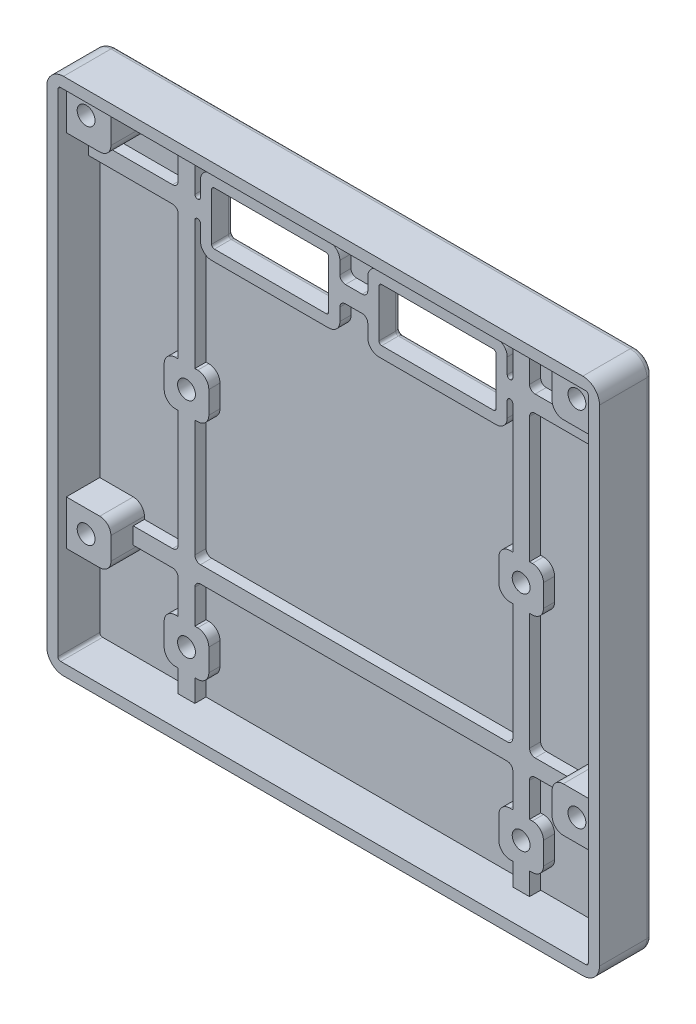
from build123d import *

# Parameters (mm, degrees)
SKETCH_1_W               = 99.1
SKETCH_1_H               = 93.1
EXTRUDE_1_DEPTH          = 2
SKETCH_2_W               = 99.1
SKETCH_2_H               = 93.1
SKETCH_2_W_2             = 95.1
SKETCH_2_H_2             = 89.1
EXTRUDE_2_DEPTH          = 7.5
SKETCH_2_3_W             = 8
SKETCH_2_3_H             = 8
EXTRUDE_3_DEPTH          = 6
SKETCH_2_4_W             = 5
SKETCH_2_4_H             = 3
SKETCH_2_4_W_2           = 25
SKETCH_2_4_H_2           = 13.5
SKETCH_2_4_W_3           = 21
SKETCH_2_4_H_3           = 9.5
SKETCH_2_4_W_4           = 8
SKETCH_2_4_H_4           = 8
SKETCH_2_4_R             = 1.6
SKETCH_2_4_W_5           = 3
SKETCH_2_4_H_5           = 4
EXTRUDE_4_DEPTH          = 2
CUT_EXTRUDE_1_DEPTH      = 69.398501446
CUT_EXTRUDE_1_DEPTH_BACK = 69.398501446
SKETCH_2_5_W             = 21
SKETCH_2_5_H             = 9.5
SKETCH_2_5_R             = 1.6
FILLET_1_R               = 3
FILLET_2_R               = 2
FILLET_3_R               = 0.5
FILLET_4_R               = 0.5
FILLET_5_R               = 1
FILLET_6_R               = 1


with BuildPart() as part:
    # Эскиз1 → Бобышка-Вытянуть1 (new body)
    with BuildSketch(Plane.XY):
        Rectangle(SKETCH_1_W, SKETCH_1_H)
    extrude(amount=EXTRUDE_1_DEPTH)

    # Эскиз2 → Бобышка-Вытянуть2 (add)
    with BuildSketch(Plane.XY.offset(2)):
        Rectangle(SKETCH_2_W, SKETCH_2_H)
        Rectangle(SKETCH_2_W_2, SKETCH_2_H_2, mode=Mode.SUBTRACT)
    extrude(amount=EXTRUDE_2_DEPTH)

    # Эскиз2<3> → Бобышка-Вытянуть3 (add)
    with BuildSketch(Plane.XY.offset(2)):
        with Locations((-43.55, 40.55)):
            Rectangle(SKETCH_2_3_W, SKETCH_2_3_H)
        with Locations((43.55, 40.55)):
            Rectangle(SKETCH_2_3_W, SKETCH_2_3_H)
        with Locations((43.55, -24)):
            Rectangle(SKETCH_2_3_W, SKETCH_2_3_H)
        with Locations((-43.55, -24)):
            Rectangle(SKETCH_2_3_W, SKETCH_2_3_H)
    extrude(amount=EXTRUDE_3_DEPTH)

    # Эскиз2<4> → Бобышка-Вытянуть4 (add)
    # profile 1 of 12: a face of its own
    with BuildSketch(Plane.XY.offset(2)):
        Polygon((-47.55, 34), (-47.55, 31), (-31.5, 31), (-31.5, 7.45), (-28.5, 7.45), (-28.5, 31), (-27.5, 31), (-27.5, 34), (-28.5, 34), (-28.5, 44.55), (-31.5, 44.55), (-31.5, 34), align=None)
    # profile 2 of 12: a face of its own
    with BuildSketch(Plane.XY.offset(2)):
        with Locations((0, 32.5)):
            Rectangle(SKETCH_2_4_W, SKETCH_2_4_H)
    # profile 3 of 12: a face of its own
    with BuildSketch(Plane.XY.offset(2)):
        with Locations((-15, 32.5)):
            Rectangle(SKETCH_2_4_W_2, SKETCH_2_4_H_2)
        with Locations((-15, 32.5)):
            Rectangle(SKETCH_2_4_W_3, SKETCH_2_4_H_3, mode=Mode.SUBTRACT)
    # profile 4 of 12: a face of its own
    with BuildSketch(Plane.XY.offset(2)):
        with Locations((15, 32.5)):
            Rectangle(SKETCH_2_4_W_2, SKETCH_2_4_H_2)
        with Locations((15, 32.5)):
            Rectangle(SKETCH_2_4_W_3, SKETCH_2_4_H_3, mode=Mode.SUBTRACT)
    # profile 5 of 12: a face of its own
    with BuildSketch(Plane.XY.offset(2)):
        Polygon((31.5, 31), (47.55, 31), (47.55, 34), (31.5, 34), (31.5, 44.55), (28.5, 44.55), (28.5, 34), (27.5, 34), (27.5, 31), (28.5, 31), (28.5, 7.45), (31.5, 7.45), align=None)
    # profile 6 of 12: a face of its own
    with BuildSketch(Plane.XY.offset(2)):
        with Locations((30, 3.45)):
            Rectangle(SKETCH_2_4_W_4, SKETCH_2_4_H_4)
        with Locations((30, 3.45)):
            Circle(SKETCH_2_4_R, mode=Mode.SUBTRACT)
    # profile 7 of 12: a face of its own
    with BuildSketch(Plane.XY.offset(2)):
        Polygon((31.5, -25.5), (39.55, -25.5), (39.55, -22.5), (31.5, -22.5), (31.5, -0.55), (28.5, -0.55), (28.5, -22.5), (-28.5, -22.5), (-28.5, -0.55), (-31.5, -0.55), (-31.5, -22.5), (-39.55, -22.5), (-39.55, -25.5), (-31.5, -25.5), (-31.5, -32.55), (-28.5, -32.55), (-28.5, -25.5), (28.5, -25.5), (28.5, -32.55), (31.5, -32.55), align=None)
    # profile 8 of 12: a face of its own
    with BuildSketch(Plane.XY.offset(2)):
        with Locations((-30, -36.55)):
            Rectangle(SKETCH_2_4_W_4, SKETCH_2_4_H_4)
        with Locations((-30, -36.55)):
            Circle(SKETCH_2_4_R, mode=Mode.SUBTRACT)
    # profile 9 of 12: a face of its own
    with BuildSketch(Plane.XY.offset(2)):
        with Locations((-30, -42.55)):
            Rectangle(SKETCH_2_4_W_5, SKETCH_2_4_H_5)
    # profile 10 of 12: a face of its own
    with BuildSketch(Plane.XY.offset(2)):
        with Locations((-30, 3.45)):
            Rectangle(SKETCH_2_4_W_4, SKETCH_2_4_H_4)
        with Locations((-30, 3.45)):
            Circle(SKETCH_2_4_R, mode=Mode.SUBTRACT)
    # profile 11 of 12: a face of its own
    with BuildSketch(Plane.XY.offset(2)):
        with Locations((30, -36.55)):
            Rectangle(SKETCH_2_4_W_4, SKETCH_2_4_H_4)
        with Locations((30, -36.55)):
            Circle(SKETCH_2_4_R, mode=Mode.SUBTRACT)
    # profile 12 of 12: a face of its own
    with BuildSketch(Plane.XY.offset(2)):
        with Locations((30, -42.55)):
            Rectangle(SKETCH_2_4_W_5, SKETCH_2_4_H_5)
    extrude(amount=EXTRUDE_4_DEPTH)

    # Эскиз2<5> → Вырез-Вытянуть1 (cut, two sides: drawn at the far end of the back side and taken through both)
    with BuildSketch(Plane.XY.offset(2).offset(-CUT_EXTRUDE_1_DEPTH_BACK)):
        with Locations((-15, 32.5)):
            Rectangle(SKETCH_2_5_W, SKETCH_2_5_H)
        with Locations((15, 32.5)):
            Rectangle(SKETCH_2_5_W, SKETCH_2_5_H)
        with Locations((-44, 41)):
            Circle(SKETCH_2_5_R)
        with Locations((-30, 3.45)):
            Circle(SKETCH_2_5_R)
        with Locations((-44, -24)):
            Circle(SKETCH_2_5_R)
        with Locations((-30, -36.55)):
            Circle(SKETCH_2_5_R)
        with Locations((30, -36.55)):
            Circle(SKETCH_2_5_R)
        with Locations((44, -24)):
            Circle(SKETCH_2_5_R)
        with Locations((30, 3.45)):
            Circle(SKETCH_2_5_R)
        with Locations((44, 41)):
            Circle(SKETCH_2_5_R)
    extrude(amount=CUT_EXTRUDE_1_DEPTH + CUT_EXTRUDE_1_DEPTH_BACK, mode=Mode.SUBTRACT)

    # Скругление1
    fillet_1_edges = [part.edges().sort_by_distance(p)[0] for p in [
        (49.55, -46.55, 4.75),
        (-49.55, -46.55, 4.75),
        (-49.55, 46.55, 4.75),
        (49.55, 46.55, 4.75),
    ]]
    fillet(fillet_1_edges, radius=FILLET_1_R)

    # Скругление2
    fillet_2_edges = [part.edges().sort_by_distance(p)[0] for p in [
        (26, 7.45, 3),
        (26, -0.55, 3),
        (-26, -0.55, 3),
        (-26, 7.45, 3),
        (-27.5, 25.75, 3),
        (-2.5, 25.75, 3),
        (2.5, 25.75, 3),
        (27.5, 25.75, 3),
        (34, 7.45, 3),
        (27.5, 39.25, 3),
        (2.5, 39.25, 3),
        (-2.5, 39.25, 3),
        (-27.5, 39.25, 3),
        (-34, 7.45, 3),
        (-34, -0.55, 3),
        (-34, -32.55, 3),
        (-34, -40.55, 3),
        (-26, -40.55, 3),
        (-26, -32.55, 3),
        (26, -32.55, 3),
        (26, -40.55, 3),
        (34, -40.55, 3),
        (34, -32.55, 3),
        (34, -0.55, 3),
        (-39.55, 36.55, 5),
        (-39.55, -28, 5),
        (-39.55, -20, 5),
        (39.55, 36.55, 5),
        (39.55, -20, 5),
        (39.55, -28, 5),
    ]]
    fillet(fillet_2_edges, radius=FILLET_2_R)

    # Скругление3
    fillet_3_edges = [part.edges().sort_by_distance(p)[0] for p in [
        (25.5, 27.75, 3),
        (4.5, 27.75, 3),
        (4.5, 37.25, 3),
        (-4.5, 37.25, 3),
        (-4.5, 27.75, 3),
        (-25.5, 27.75, 3),
        (25.5, 37.25, 3),
        (-25.5, 37.25, 3),
    ]]
    fillet(fillet_3_edges, radius=FILLET_3_R)

    # Скругление4
    fillet_4_edges = [part.edges().sort_by_distance(p)[0] for p in [
        (28.5, 34, 3),
        (27.5, 34, 3),
        (28.5, 31, 3),
        (27.5, 31, 3),
        (-27.5, 34, 3),
        (-27.5, 31, 3),
        (-28.5, 34, 3),
        (-28.5, 31, 3),
        (47.55, -44.55, 5.75),
        (47.55, 44.55, 8.75),
        (-47.55, 44.55, 8.75),
        (-47.55, -44.55, 5.75),
    ]]
    fillet(fillet_4_edges, radius=FILLET_4_R - 0.0001)  # a hair under: the kernel refuses the full size

    # Скругление5
    fillet_5_edges = [part.edges().sort_by_distance(p)[0] for p in [
        (28.5, -22.5, 3),
        (-28.5, -22.5, 3),
        (-2.5, 31, 3),
        (2.5, 31, 3),
        (31.5, 31, 3),
        (31.5, 34, 3),
        (2.5, 34, 3),
        (-2.5, 34, 3),
        (-31.5, 34, 3),
        (-31.5, 31, 3),
        (-31.5, -22.5, 3),
        (-31.5, -25.5, 3),
        (-28.5, -25.5, 3),
        (28.5, -25.5, 3),
        (31.5, -25.5, 3),
        (31.5, -22.5, 3),
    ]]
    fillet(fillet_5_edges, radius=FILLET_5_R)

    # Скругление6
    fillet_6_edges = [part.edges().sort_by_distance(p)[0] for p in [
        (-49.55, 0, 0),
        (49.55, 0, 0),
        (0, -46.55, 0),
        (0, 46.55, 0),
        (-48.671320344, -45.671320344, 0),
        (48.671320344, -45.671320344, 0),
        (48.671320344, 45.671320344, 0),
        (-48.671320344, 45.671320344, 0),
        (25.5, 32.5, 0),
        (15, 37.25, 0),
        (15, 27.75, 0),
        (4.5, 32.5, 0),
        (-15, 27.75, 0),
        (-4.5, 32.5, 0),
        (-15, 37.25, 0),
        (-25.5, 32.5, 0),
        (25.353553391, 37.103553391, 0),
        (25.353553391, 27.896446609, 0),
        (4.646446609, 37.103553391, 0),
        (4.646446609, 27.896446609, 0),
        (-4.646446609, 27.896446609, 0),
        (-4.646446609, 37.103553391, 0),
        (-25.353553391, 27.896446609, 0),
        (-25.353553391, 37.103553391, 0),
    ]]
    fillet(fillet_6_edges, radius=FILLET_6_R)


solid = part.part
